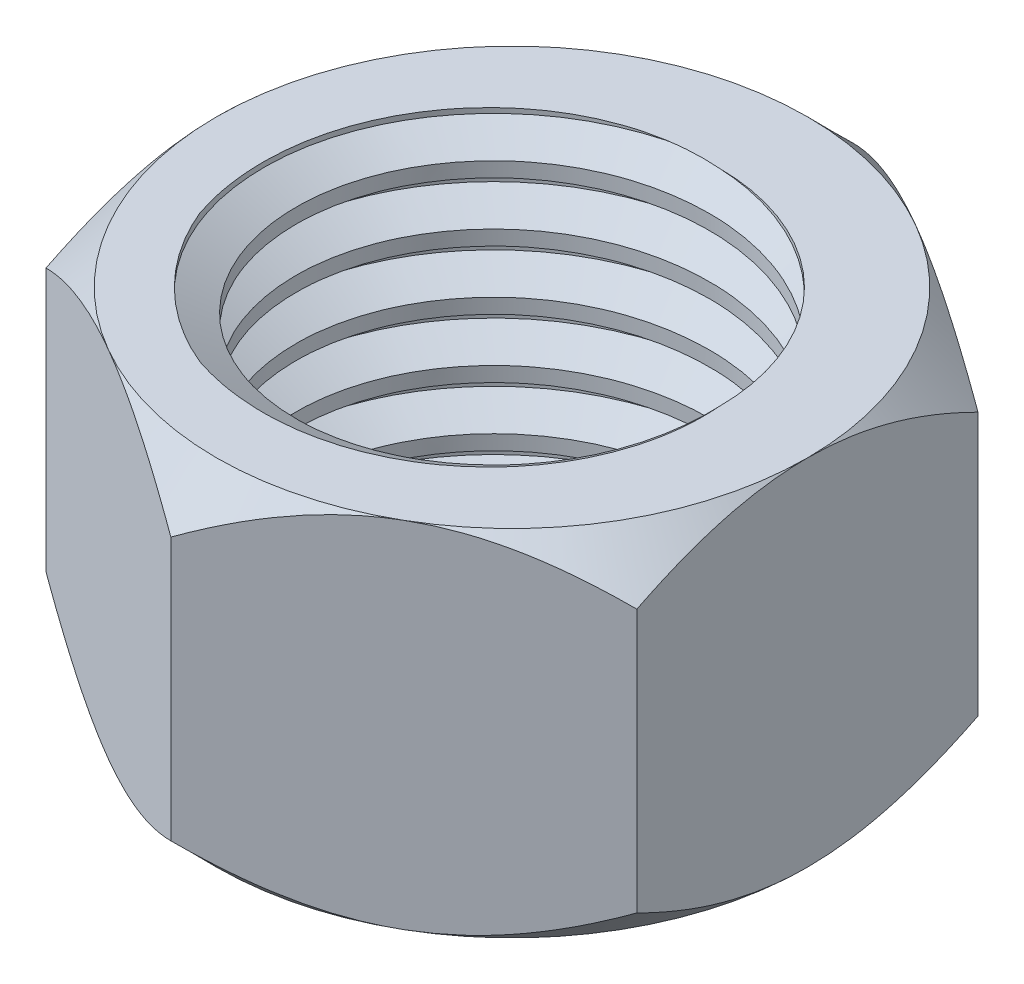
from build123d import *

# Parameters (mm, degrees)
BOSS_EXTRUDE1_DEPTH     = 3
SKETCH9_OUTSIDE_W       = 36.708
SKETCH9_OUTSIDE_H       = 38.256
SKETCH9_OUTSIDE_R       = 5
CUT_EXTRUDE3_DEPTH      = 10.712534856
CUT_EXTRUDE3_DRAFT      = -45
MIRROR1_COPY_1_SKETCH_W = 36.708
MIRROR1_COPY_1_SKETCH_H = 38.256
MIRROR1_COPY_1_SKETCH_R = 5
MIRROR1_COPY_1_DEPTH    = 10.712534856
MIRROR1_COPY_1_DRAFT    = -45
SKETCH10_R              = 3.5
CUT_EXTRUDE4_DEPTH      = 10.712534856
THREAD1_PITCH           = 1


with BuildPart() as part:
    # Sketch1 → Boss-Extrude1 (new, symmetric)
    with BuildSketch(Plane(origin=(0, 0, 0), x_dir=(1, 0, 0), z_dir=(0, 1, 0))):
        Polygon((0, 5.773502692), (-5, 2.886751346), (-5, -2.886751346), (0, -5.773502692), (5, -2.886751346), (5, 2.886751346), align=None)
    extrude(amount=BOSS_EXTRUDE1_DEPTH, both=True)


with BuildPart() as cut_extrude3_tool:
    # Sketch9 outside → Cut-Extrude3 (with draft: the straight prism first)
    with BuildSketch(Plane(origin=(0, 3, 0), x_dir=(1, 0, 0), z_dir=(0, 1, 0))):
        Rectangle(SKETCH9_OUTSIDE_W, SKETCH9_OUTSIDE_H)
        Circle(SKETCH9_OUTSIDE_R, mode=Mode.SUBTRACT)
    extrude(amount=-CUT_EXTRUDE3_DEPTH)
    # Cut-Extrude3: the draft: its side faces are tilted about the plane it starts from
    cut_extrude3_sides = [cut_extrude3_tool.faces().sort_by_distance(p)[0] for p in [
        (0, -2.356267428, 19.128),
        (18.354, -2.356267428, 0),
        (0, -2.356267428, -19.128),
        (-18.354, -2.356267428, 0),
        (-5, -2.356267428, 0),
    ]]
    draft(cut_extrude3_sides, Plane(origin=(0, 3, 0), x_dir=(1, 0, 0), z_dir=(0, 1, 0)), CUT_EXTRUDE3_DRAFT)


with BuildPart() as part_1:
    add(part.part)

    # Cut-Extrude3: cut by cut_extrude3_tool
    add(cut_extrude3_tool.part, mode=Mode.SUBTRACT)


with BuildPart() as mirror1_copy_1_tool:
    # Mirror1 copy 1 sketch → Mirror1 copy 1 (with draft: the straight prism first)
    with BuildSketch(Plane.XZ.offset(3)):
        Rectangle(MIRROR1_COPY_1_SKETCH_W, MIRROR1_COPY_1_SKETCH_H)
        Circle(MIRROR1_COPY_1_SKETCH_R, mode=Mode.SUBTRACT)
    extrude(amount=-MIRROR1_COPY_1_DEPTH)
    # Mirror1 copy 1: the draft: its side faces are tilted about the plane it starts from
    mirror1_copy_1_sides = [mirror1_copy_1_tool.faces().sort_by_distance(p)[0] for p in [
        (0, 2.356267428, 19.128),
        (18.354, 2.356267428, 0),
        (0, 2.356267428, -19.128),
        (-18.354, 2.356267428, 0),
        (-5, 2.356267428, 0),
    ]]
    draft(mirror1_copy_1_sides, Plane.XZ.offset(3), MIRROR1_COPY_1_DRAFT)


with BuildPart() as part_2:
    add(part_1.part)

    # Mirror1 copy 1: cut by mirror1_copy_1_tool
    add(mirror1_copy_1_tool.part, mode=Mode.SUBTRACT)

    # Sketch10 → Cut-Extrude4 (cut, through all)
    with BuildSketch(Plane(origin=(0, 3, 0), x_dir=(1, 0, 0), z_dir=(0, 1, 0))):
        with Locations(Location((0, 0, 0), (0, 0, 270))):
            Circle(SKETCH10_R)
    extrude(amount=-CUT_EXTRUDE4_DEPTH, mode=Mode.SUBTRACT)

    # Thread1: the profile of Thread Profile2 profile screwed along a right-hand helix of 7 turns, 8 arcs to a turn; built about Z, then put on its axis
    thread1_z = Axis((0, 0, 0), (0, 0, 1))
    thread1_corners = [(3.4997, 0, -0.000173205), (4.041265875, 0, 0.312499999), (4.041265875, 0, 0.437499999), (3.4997, 0, 0.750173202)]
    with BuildLine(mode=Mode.PRIVATE) as thread1_profile:
        Line(thread1_corners[0], thread1_corners[1])
        Line(thread1_corners[1], thread1_corners[2])
        Line(thread1_corners[2], thread1_corners[3])
        Line(thread1_corners[3], thread1_corners[0])
    thread1_cap = Face(thread1_profile.wire())
    thread1_turn_angles = [0, 22.5, 45, 67.5, 90, 112.5, 135, 157.5, 180, 202.5, 225, 247.5, 270, 292.5, 315, 337.5, 360]
    thread1_turn_weights = [1, 0.9238795325112867, 1, 0.9238795325112867, 1, 0.9238795325112867, 1, 0.9238795325112867, 1, 0.9238795325112867, 1, 0.9238795325112867, 1, 0.9238795325112867, 1, 0.9238795325112867, 1]
    thread1_turn_rails = [Edge.make_bspline([Vector(p[0], p[1], 0).rotate(thread1_z, thread1_turn_angles[k]) / thread1_turn_weights[k] + Vector(0, 0, p[2] + THREAD1_PITCH * thread1_turn_angles[k] / 360) for k in range(17)], [0, 0, 0, 1, 1, 2, 2, 3, 3, 4, 4, 5, 5, 6, 6, 7, 7, 8, 8, 8], 2, thread1_turn_weights) for p in thread1_corners]
    thread1_turn_sides = [Face.make_surface_from_curves(thread1_turn_rails[p[0]], thread1_turn_rails[p[1]]) for p in [(0, 1), (1, 2), (2, 3), (3, 0)]]
    thread1 = Plane(origin=(0, -4, 0), x_dir=(1, 0, 0), z_dir=(0, 1, 0)) * Solid(Shell([*[p.moved(Location((0, 0, THREAD1_PITCH * i))) for i in range(7) for p in thread1_turn_sides], thread1_cap, thread1_cap.rotate(thread1_z, 2520).moved(Location((0, 0, THREAD1_PITCH * 2520 / 360)))]))
    add(thread1, mode=Mode.SUBTRACT)


solid = part_2.part
